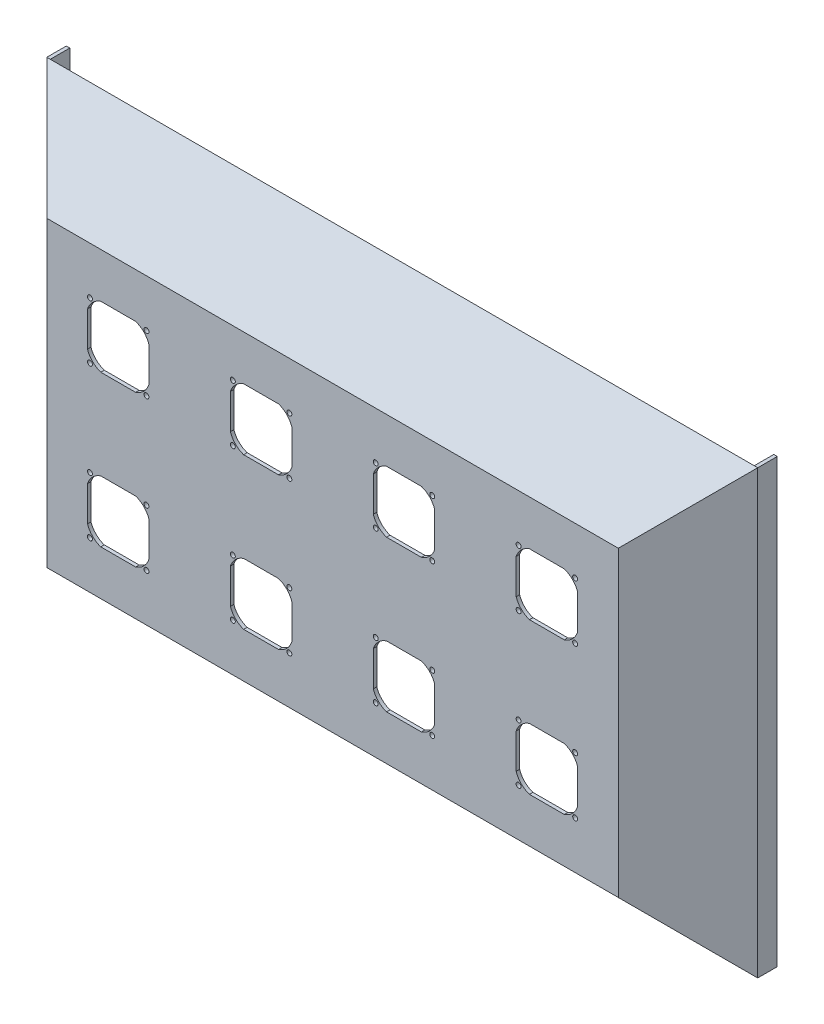
from build123d import *

# Parameters (mm, degrees)
SKETCH1_W               = 647.7
SKETCH1_H               = 402.59
BOSS_EXTRUDE1_DEPTH     = 63.5
CHAMFER1_SIZE           = 63.5
CHAMFER2_SIZE           = 63.5
SKETCH3_W               = 647.7
SKETCH3_H               = 402.59
BOSS_EXTRUDE2_DEPTH     = 17.78
SHELL1_T                = -3.175
SKETCH4_W               = 641.35
SKETCH4_H               = 3.175
CUT_EXTRUDE1_DEPTH      = 17.78
CUT_EXTRUDE3_DEPTH      = 390.878106496
CUT_EXTRUDE3_DEPTH_BACK = 390.878106496
SKETCH2_R               = 2.25


with BuildPart() as part:
    # Sketch1 → Boss-Extrude1 (new body)
    with BuildSketch(Plane.XY):
        Rectangle(SKETCH1_W, SKETCH1_H)
    extrude(amount=BOSS_EXTRUDE1_DEPTH)

    # Chamfer1
    chamfer1_edges = [part.edges().sort_by_distance(p)[0] for p in [
        (0, 201.295, 63.5),
        (0, -201.295, 63.5),
    ]]
    chamfer(chamfer1_edges, length=CHAMFER1_SIZE - 0.0001)  # a hair under: the kernel refuses the full size

    # Chamfer2
    chamfer2_edges = [part.edges().sort_by_distance(p)[0] for p in [
        (-323.85, 0, 63.5),
        (323.85, 0, 63.5),
    ]]
    chamfer(chamfer2_edges, length=CHAMFER2_SIZE - 0.0001)  # a hair under: the kernel refuses the full size

    # Sketch3 → Boss-Extrude2 (add)
    with BuildSketch(Plane.XY):
        Rectangle(SKETCH3_W, SKETCH3_H)
    extrude(amount=-BOSS_EXTRUDE2_DEPTH)

    # Shell1
    shell1_openings = [part.faces().sort_by_distance(p)[0] for p in [
        (0, 0, -17.78),
    ]]
    offset(amount=SHELL1_T, openings=shell1_openings, kind=Kind.INTERSECTION)

    # Sketch4 → Cut-Extrude1 (cut)
    with BuildSketch(Plane(origin=(0, 0, -17.78), x_dir=(-1, 0, 0), z_dir=(0, 0, -1))):
        with Locations((0, 199.7075)):
            Rectangle(SKETCH4_W, SKETCH4_H)
    extrude(amount=-CUT_EXTRUDE1_DEPTH, mode=Mode.SUBTRACT)

    # Sketch2 → Cut-Extrude3 (cut, two sides: drawn at the far end of the back side and taken through both)
    with BuildSketch(Plane.XY.offset(63.5).offset(-CUT_EXTRUDE3_DEPTH_BACK)):
        with BuildLine():
            Line((-37.107499953, 53.0225), (-37.107499953, 84.7725))
            ThreePointArc((-37.107499953, 84.7725), (-41.723671365, 92.261328635), (-49.2125, 96.877500047))
            Line((-49.2125, 96.877500047), (-80.9625, 96.877500047))
            ThreePointArc((-80.9625, 96.877500047), (-88.451328635, 92.261328635), (-93.067500047, 84.7725))
            Line((-93.067500047, 84.7725), (-93.067500047, 53.0225))
            ThreePointArc((-93.067500047, 53.0225), (-88.451328635, 45.533671365), (-80.9625, 40.917499953))
            Line((-80.9625, 40.917499953), (-49.2125, 40.917499953))
            ThreePointArc((-49.2125, 40.917499953), (-41.723671365, 45.533671365), (-37.107499953, 53.0225))
        make_face()
        with Locations((-221.012500062, 43.147499938)):
            Circle(SKETCH2_R)
        with Locations((-169.512499938, 43.147499938)):
            Circle(SKETCH2_R)
        with Locations((-39.337499938, 94.647500062)):
            Circle(SKETCH2_R)
        with Locations((-90.837500062, 43.147499938)):
            Circle(SKETCH2_R)
        with Locations((-39.337499938, 43.147499938)):
            Circle(SKETCH2_R)
        with BuildLine():
            ThreePointArc((80.9625, 96.877500047), (88.451328635, 92.261328635), (93.067500047, 84.7725))
            Line((93.067500047, 84.7725), (93.067500047, 53.0225))
            ThreePointArc((93.067500047, 53.0225), (88.451328635, 45.533671365), (80.9625, 40.917499953))
            Line((80.9625, 40.917499953), (49.2125, 40.917499953))
            ThreePointArc((49.2125, 40.917499953), (41.723671365, 45.533671365), (37.107499953, 53.0225))
            Line((37.107499953, 53.0225), (37.107499953, 84.7725))
            ThreePointArc((37.107499953, 84.7725), (41.723671365, 92.261328635), (49.2125, 96.877500047))
            Line((49.2125, 96.877500047), (80.9625, 96.877500047))
        make_face()
        with BuildLine():
            Line((223.242500047, 53.0225), (223.242500047, 84.7725))
            ThreePointArc((223.242500047, 84.7725), (218.626328635, 92.261328635), (211.1375, 96.877500047))
            Line((211.1375, 96.877500047), (179.3875, 96.877500047))
            ThreePointArc((179.3875, 96.877500047), (171.898671365, 92.261328635), (167.282499953, 84.7725))
            Line((167.282499953, 84.7725), (167.282499953, 53.0225))
            ThreePointArc((167.282499953, 53.0225), (171.898671365, 45.533671365), (179.3875, 40.917499953))
            Line((179.3875, 40.917499953), (211.1375, 40.917499953))
            ThreePointArc((211.1375, 40.917499953), (218.626328635, 45.533671365), (223.242500047, 53.0225))
        make_face()
        with BuildLine():
            Line((-223.242500047, -53.0225), (-223.242500047, -84.7725))
            ThreePointArc((-223.242500047, -84.7725), (-218.626328635, -92.261328635), (-211.1375, -96.877500047))
            Line((-211.1375, -96.877500047), (-179.3875, -96.877500047))
            ThreePointArc((-179.3875, -96.877500047), (-171.898671365, -92.261328635), (-167.282499953, -84.7725))
            Line((-167.282499953, -84.7725), (-167.282499953, -53.0225))
            ThreePointArc((-167.282499953, -53.0225), (-171.898671365, -45.533671365), (-179.3875, -40.917499953))
            Line((-179.3875, -40.917499953), (-211.1375, -40.917499953))
            ThreePointArc((-211.1375, -40.917499953), (-218.626328635, -45.533671365), (-223.242500047, -53.0225))
        make_face()
        with BuildLine():
            ThreePointArc((-80.9625, -96.877500047), (-88.451328635, -92.261328635), (-93.067500047, -84.7725))
            Line((-93.067500047, -84.7725), (-93.067500047, -53.0225))
            ThreePointArc((-93.067500047, -53.0225), (-88.451328635, -45.533671365), (-80.9625, -40.917499953))
            Line((-80.9625, -40.917499953), (-49.2125, -40.917499953))
            ThreePointArc((-49.2125, -40.917499953), (-41.723671365, -45.533671365), (-37.107499953, -53.0225))
            Line((-37.107499953, -53.0225), (-37.107499953, -84.7725))
            ThreePointArc((-37.107499953, -84.7725), (-41.723671365, -92.261328635), (-49.2125, -96.877500047))
            Line((-49.2125, -96.877500047), (-80.9625, -96.877500047))
        make_face()
        with BuildLine():
            Line((37.107499953, -53.0225), (37.107499953, -84.7725))
            ThreePointArc((37.107499953, -84.7725), (41.723671365, -92.261328635), (49.2125, -96.877500047))
            Line((49.2125, -96.877500047), (80.9625, -96.877500047))
            ThreePointArc((80.9625, -96.877500047), (88.451328635, -92.261328635), (93.067500047, -84.7725))
            Line((93.067500047, -84.7725), (93.067500047, -53.0225))
            ThreePointArc((93.067500047, -53.0225), (88.451328635, -45.533671365), (80.9625, -40.917499953))
            Line((80.9625, -40.917499953), (49.2125, -40.917499953))
            ThreePointArc((49.2125, -40.917499953), (41.723671365, -45.533671365), (37.107499953, -53.0225))
        make_face()
        with BuildLine():
            ThreePointArc((179.3875, -96.877500047), (171.898671365, -92.261328635), (167.282499953, -84.7725))
            Line((167.282499953, -84.7725), (167.282499953, -53.0225))
            ThreePointArc((167.282499953, -53.0225), (171.898671365, -45.533671365), (179.3875, -40.917499953))
            Line((179.3875, -40.917499953), (211.1375, -40.917499953))
            ThreePointArc((211.1375, -40.917499953), (218.626328635, -45.533671365), (223.242500047, -53.0225))
            Line((223.242500047, -53.0225), (223.242500047, -84.7725))
            ThreePointArc((223.242500047, -84.7725), (218.626328635, -92.261328635), (211.1375, -96.877500047))
            Line((211.1375, -96.877500047), (179.3875, -96.877500047))
        make_face()
        with Locations((39.337499938, 94.647500062)):
            Circle(SKETCH2_R)
        with Locations((90.837500062, 94.647500062)):
            Circle(SKETCH2_R)
        with Locations((90.837500062, 43.147499938)):
            Circle(SKETCH2_R)
        with Locations((-221.012500062, -43.147499938)):
            Circle(SKETCH2_R)
        with Locations((-169.512499938, -43.147499938)):
            Circle(SKETCH2_R)
        with Locations((-169.512499938, -94.647500062)):
            Circle(SKETCH2_R)
        with Locations((-90.837500062, -43.147499938)):
            Circle(SKETCH2_R)
        with Locations((-39.337499938, -43.147499938)):
            Circle(SKETCH2_R)
        with Locations((-90.837500062, -94.647500062)):
            Circle(SKETCH2_R)
        with Locations((39.337499938, -43.147499938)):
            Circle(SKETCH2_R)
        with Locations((39.337499938, -94.647500062)):
            Circle(SKETCH2_R)
        with Locations((90.837500062, -43.147499938)):
            Circle(SKETCH2_R)
        with Locations((90.837500062, -94.647500062)):
            Circle(SKETCH2_R)
        with Locations((169.512499938, -43.147499938)):
            Circle(SKETCH2_R)
        with Locations((221.012500062, -43.147499938)):
            Circle(SKETCH2_R)
        with Locations((169.512499938, -94.647500062)):
            Circle(SKETCH2_R)
        with Locations((221.012500062, -94.647500062)):
            Circle(SKETCH2_R)
        with BuildLine():
            ThreePointArc((-223.242500047, 84.7725), (-218.626328635, 92.261328635), (-211.1375, 96.877500047))
            Line((-211.1375, 96.877500047), (-179.3875, 96.877500047))
            ThreePointArc((-179.3875, 96.877500047), (-171.898671365, 92.261328635), (-167.282499953, 84.7725))
            Line((-167.282499953, 84.7725), (-167.282499953, 53.0225))
            ThreePointArc((-167.282499953, 53.0225), (-171.898671365, 45.533671365), (-179.3875, 40.917499953))
            Line((-179.3875, 40.917499953), (-211.1375, 40.917499953))
            ThreePointArc((-211.1375, 40.917499953), (-218.626328635, 45.533671365), (-223.242500047, 53.0225))
            Line((-223.242500047, 53.0225), (-223.242500047, 84.7725))
        make_face()
        with Locations((-221.012500062, 94.647500062)):
            Circle(SKETCH2_R)
        with Locations((-169.512499938, 94.647500062)):
            Circle(SKETCH2_R)
        with Locations((-90.837500062, 94.647500062)):
            Circle(SKETCH2_R)
        with Locations((39.337499938, 43.147499938)):
            Circle(SKETCH2_R)
        with Locations((169.512499938, 94.647500062)):
            Circle(SKETCH2_R)
        with Locations((169.512499938, 43.147499938)):
            Circle(SKETCH2_R)
        with Locations((221.012500062, 94.647500062)):
            Circle(SKETCH2_R)
        with Locations((221.012500062, 43.147499938)):
            Circle(SKETCH2_R)
        with Locations((-221.012500062, -94.647500062)):
            Circle(SKETCH2_R)
        with Locations((-39.337499938, -94.647500062)):
            Circle(SKETCH2_R)
    extrude(amount=CUT_EXTRUDE3_DEPTH + CUT_EXTRUDE3_DEPTH_BACK, mode=Mode.SUBTRACT)


solid = part.part
